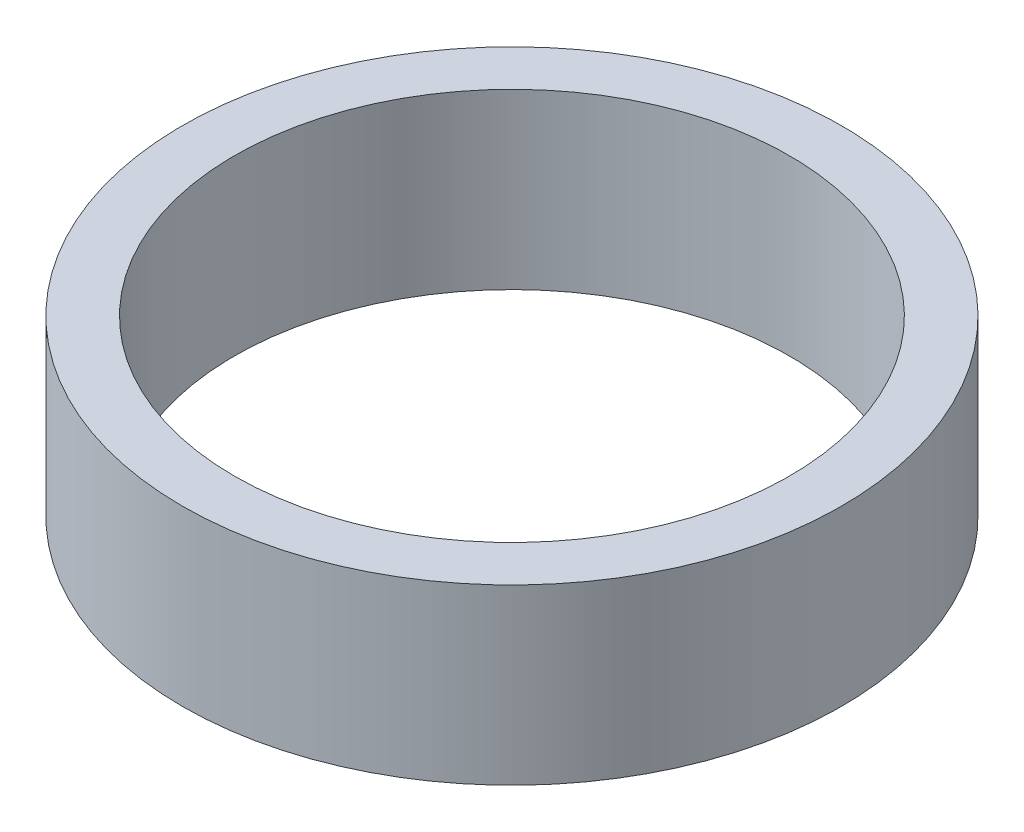
from build123d import *

# Parameters (mm, degrees)
SKETCH1_R           = 47.5
BOSS_EXTRUDE1_DEPTH = 25
SKETCH2_R           = 40
CUT_EXTRUDE1_DEPTH  = 72.676355934


with BuildPart() as part:
    # Sketch1 → Boss-Extrude1 (new body)
    with BuildSketch(Plane(origin=(0, 0, 0), x_dir=(1, 0, 0), z_dir=(0, 1, 0))):
        Circle(SKETCH1_R)
    extrude(amount=BOSS_EXTRUDE1_DEPTH)

    # Sketch2 → Cut-Extrude1 (cut, through all)
    with BuildSketch(Plane(origin=(0, 0, 0), x_dir=(1, 0, 0), z_dir=(0, 1, 0))):
        Circle(SKETCH2_R)
    extrude(amount=CUT_EXTRUDE1_DEPTH, mode=Mode.SUBTRACT)


solid = part.part
